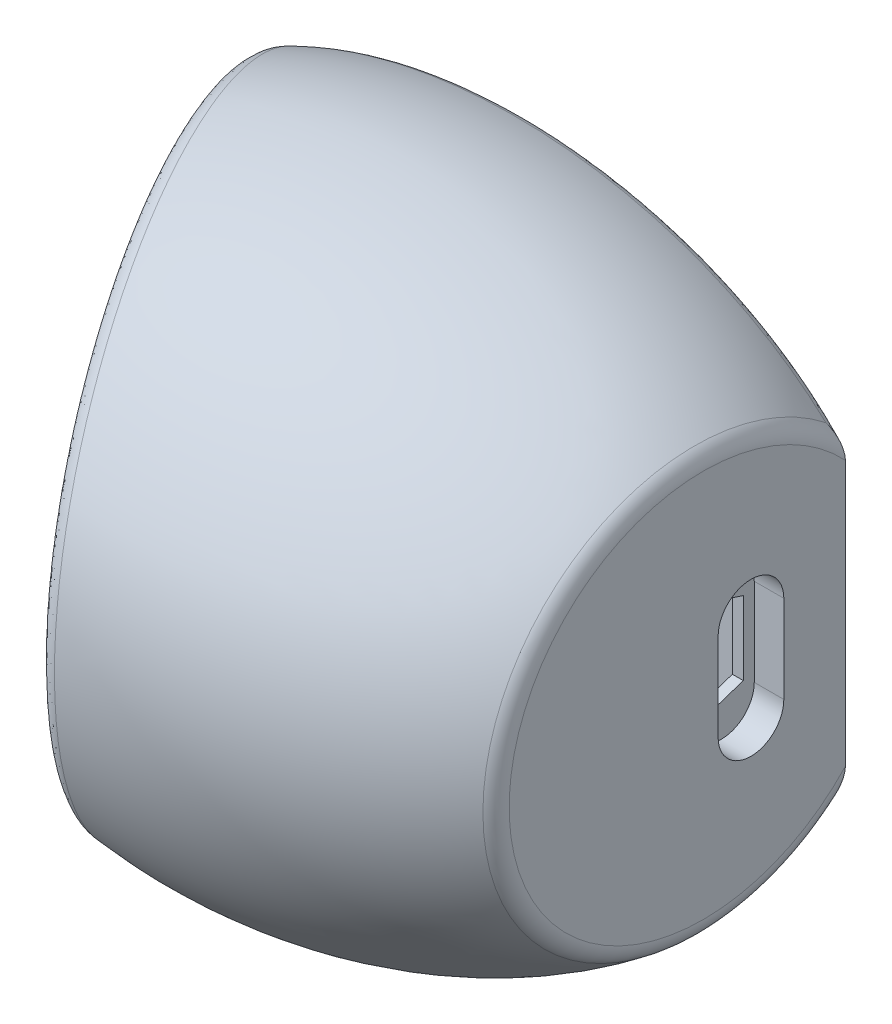
from build123d import *

# Parameters (mm, degrees)
ENL_V_MAT_EXTRU_1_DEPTH      = 56.578773097
ENL_V_MAT_EXTRU_1_DEPTH_BACK = 56.578773097
ENL_V_MAT_EXTRU_2_DEPTH      = 56.578773097
ENL_V_MAT_EXTRU_2_DEPTH_BACK = 56.578773097
ENL_V_MAT_EXTRU_4_DEPTH      = 51.923385764
ENL_V_MAT_EXTRU_4_DEPTH_BACK = 51.923385764
ENL_V_START                  = -3.5
ESQUISSE7_W                  = 14
ESQUISSE7_H                  = 27.96
ENL_V_MAT_EXTRU_6_DEPTH      = 3.5
CONG_2_R                     = 2
CONG_4_R                     = 2
CONG_5_R                     = 2
ESQUISSE9_W                  = 28.42
ESQUISSE9_H                  = 28.16
ENL_V_MAT_EXTRU_7_DEPTH      = 2
ENL_V_MAT_EXTRU_8_DEPTH      = 1.3
ESQUISSE11_W                 = 2.9
ESQUISSE11_H                 = 10.4
ENL_V_MAT_EXTRU_9_DEPTH      = 2
ESQUISSE12_W                 = 31.3
ESQUISSE12_H                 = 32.54
ENL_V_MAT_EXTRU_10_DEPTH     = 17.52
ENL_V_START_2                = -13.78
ENL_V_MAT_EXTRU_11_DEPTH     = 27.56
ENL_V_MAT_EXTRU_5_REACH      = 67.053
ESQUISSE17_W                 = 3
ESQUISSE17_H                 = 32.54
ENL_V_MAT_EXTRU_12_DEPTH     = 6
ESQUISSE18_W                 = 17.52
ESQUISSE18_H                 = 10
ENL_V_MAT_EXTRU_13_DEPTH     = 0.5
ENL_V_MAT_EXTRU_14_DEPTH     = 2.7
ENL_V_MAT_EXTRU_15_DEPTH     = 6.5
ESQUISSE21_W                 = 7.413753449
ESQUISSE21_H                 = 27.56
ENL_V_MAT_EXTRU_16_DEPTH     = 3
ESQUISSE22_W                 = 3.359225522
ESQUISSE22_H                 = 3
ENL_V_MAT_EXTRU_17_DEPTH     = 31.3
CONG_6_R                     = 3


with BuildPart() as part:
    # Esquisse1 → Révolution1 (revolve)
    with BuildSketch(Plane.XY):
        with BuildLine():
            Line((-39, 0), (39, 0))
            add(Edge.make_bspline(
                [(39, 0), (39, 13.18885074), (24.836598095, 21.587983693)],
                knots=[3.141592654, 3.141592654, 3.141592654, 4.022001667, 4.022001667, 4.022001667], degree=2, weights=[1, 0.904664537, 1]))
            add(Edge.make_bspline(
                [(24.836598095, 21.587983693), (0.985525856, 35.732066319), (-23.626759148, 22.276969438)],
                knots=[4.022001667, 4.022001667, 4.022001667, 5.363177993, 5.363177993, 5.363177993], degree=2, weights=[1, 0.783456289, 1]))
            add(Edge.make_bspline(
                [(-23.626759148, 22.276969438), (-39, 13.872693077), (-39, 0)],
                knots=[5.363177993, 5.363177993, 5.363177993, 6.283185307, 6.283185307, 6.283185307], degree=2, weights=[1, 0.896050874, 1]))
        make_face()
    revolve(axis=Axis((-47.667144621, 0, 0), (1, 0, 0)))

    # Esquisse2 → Enlèv. mat.-Extru.1 (cut, two sides: drawn at the far end of the back side and taken through both)
    with BuildSketch(Plane(origin=(0, 0, 0), x_dir=(1, 0, 0), z_dir=(0, 1, 0)).offset(-ENL_V_MAT_EXTRU_1_DEPTH_BACK)):
        Polygon((-315.375795344, 13), (-49.778851167, 13), (82.043171785, 13), (347.640115963, 13), (347.640115963, 544.193888355), (-315.375795344, 544.193888355), align=None)
    extrude(amount=ENL_V_MAT_EXTRU_1_DEPTH + ENL_V_MAT_EXTRU_1_DEPTH_BACK, mode=Mode.SUBTRACT)

    # Esquisse3 → Enlèv. mat.-Extru.2 (cut, two sides: drawn at the far end of the back side and taken through both)
    with BuildSketch(Plane(origin=(0, 0, 0), x_dir=(1, 0, 0), z_dir=(0, 1, 0)).offset(-ENL_V_MAT_EXTRU_2_DEPTH_BACK)):
        Polygon((70.806261288, -187.337541094), (0, -35.493023747), (-24.944206631, 18), (-95.750467919, 169.844517347), (-399.439502613, 28.231994771), (-232.882773406, -328.95006367), align=None)
    extrude(amount=ENL_V_MAT_EXTRU_2_DEPTH + ENL_V_MAT_EXTRU_2_DEPTH_BACK, mode=Mode.SUBTRACT)

    # Esquisse4 → Enlèv. mat.-Extru.4 (cut, two sides: drawn at the far end of the back side and taken through both)
    with BuildSketch(Plane(origin=(9.15, 0, -0.29), x_dir=(0, 0, -1), z_dir=(0, -1, 0)).offset(-ENL_V_MAT_EXTRU_4_DEPTH_BACK)):
        Polygon((-206.938366836, 19.85), (-40.406748296, 19.85), (30.545952829, 19.85), (197.077571368, 19.85), (197.077571368, 352.913237079), (-206.938366836, 352.913237079), align=None)
    extrude(amount=ENL_V_MAT_EXTRU_4_DEPTH + ENL_V_MAT_EXTRU_4_DEPTH_BACK, mode=Mode.SUBTRACT)

    # Esquisse7 → Enlèv. mat.-Extru.6 (cut)
    with BuildSketch(Plane(origin=(-13.594616806, 0, 6.339273926), x_dir=(0.422618261740694, 0, 0.9063077870366525), z_dir=(-0.9063077870366525, 0, 0.422618261740694)).offset(ENL_V_START)):
        with Locations((-1.329929695, 0)):
            Rectangle(ESQUISSE7_W, ESQUISSE7_H)
    extrude(amount=ENL_V_MAT_EXTRU_6_DEPTH, mode=Mode.SUBTRACT)

    # Congé2
    cong_2_edges = [part.edges().sort_by_distance(p)[0] for p in [
        (1.344735833, 24.780393561, -13),
        (-4.095536152, -7.869163051, 26.710118127),
        (1.344735833, -24.780393561, -13),
        (29, -7.009922614, 17.359931767),
    ]]
    fillet(cong_2_edges, radius=CONG_2_R)

    # Congé4
    cong_4_edges = [part.edges().sort_by_distance(p)[0] for p in [
        (-9.612302922, -13.98, 10.738520839),
        (-15.528958586, -13.98, -1.94978818),
        (-15.528958586, 13.98, -1.94978818),
        (-9.612302922, 13.98, 10.738520839),
    ]]
    fillet(cong_4_edges, radius=CONG_4_R)

    # Congé5
    cong_5_edges = [part.edges().sort_by_distance(p)[0] for p in [
        (-14.156669381, -13.98, 5.133948288),
        (-17.114997214, 0, -1.210206222),
        (-14.156669381, 13.98, 5.133948288),
        (-11.198341549, 0, 11.478102797),
        (-16.867433168, -13.394213562, -0.679303412),
        (-16.867433168, 13.394213562, -0.679303412),
        (-11.445905595, 13.394213562, 10.947199987),
        (-11.445905595, -13.394213562, 10.947199987),
    ]]
    fillet(cong_5_edges, radius=CONG_5_R)

    # Esquisse9 → Enlèv. mat.-Extru.7 (cut)
    with BuildSketch(Plane(origin=(-10.422539551, 0, 4.86011001), x_dir=(0.42261826174069395, 0, 0.9063077870366525), z_dir=(-0.9063077870366525, 0, 0.42261826174069395))):
        with Locations((1.360070305, 0)):
            Rectangle(ESQUISSE9_W, ESQUISSE9_H)
    extrude(amount=-ENL_V_MAT_EXTRU_7_DEPTH, mode=Mode.SUBTRACT)

    # Esquisse10 → Enlèv. mat.-Extru.8 (cut)
    with BuildSketch(Plane(origin=(-10.422539551, 0, 4.86011001), x_dir=(-0.4226182617406939, 0, -0.9063077870366525), z_dir=(0.9063077870366525, 0, -0.4226182617406939))):
        Polygon((8.329929695, 13.98), (-11.170070305, 13.98), (-11.170070305, 6), (-11.170070305, -6), (-11.170070305, -13.98), (8.329929695, -13.98), align=None)
    extrude(amount=-ENL_V_MAT_EXTRU_8_DEPTH, mode=Mode.SUBTRACT)

    # Esquisse11 → Enlèv. mat.-Extru.9 (cut)
    with BuildSketch(Plane(origin=(-10.422539551, 0, 4.86011001), x_dir=(-0.4226182617406939, 0, -0.9063077870366525), z_dir=(0.9063077870366525, 0, -0.4226182617406939))):
        with Locations((10.949929695, -0.22)):
            Rectangle(ESQUISSE11_W, ESQUISSE11_H)
    extrude(amount=-ENL_V_MAT_EXTRU_9_DEPTH, mode=Mode.SUBTRACT)

    # Esquisse12 → Enlèv. mat.-Extru.10 (cut)
    with BuildSketch(Plane(origin=(0, 0, -7), x_dir=(-1, 0, 0), z_dir=(0, 0, -1))):
        with Locations((-9.15, 0)):
            Rectangle(ESQUISSE12_W, ESQUISSE12_H)
    extrude(amount=-ENL_V_MAT_EXTRU_10_DEPTH, mode=Mode.SUBTRACT)

    # Enlèv. mat.-Extru.11: read off the stored shape, not the designer's step
    # Enlèv. mat.-Extru.11 outline → Enlèv. mat.-Extru.11 (cut)
    with BuildSketch(Plane(origin=(0, 0, 0), x_dir=(1, 0, 0), z_dir=(0, 1, 0)).offset(ENL_V_START_2)):
        Polygon((-6.5, -8.539620057), (-6.5, 7.359225522), (-13.913753449, 7.359225522), align=None)
    extrude(amount=ENL_V_MAT_EXTRU_11_DEPTH, mode=Mode.SUBTRACT)

    # Esquisse5 → Enlèv. mat.-Extru.5 (cut, up to next)
    with BuildSketch(Plane(origin=(29, 0, 0), x_dir=(0, 0, -1), z_dir=(1, 0, 0)), mode=Mode.PRIVATE) as enl_v_mat_extru_5_sk1:
        Polygon((6.35, 3.36037961), (2.35, 4.693712943), (2.35, -4.693712943), (6.35, -3.36037961), align=None)
    enl_v_mat_extru_5_tool1 = extrude(enl_v_mat_extru_5_sk1.sketch, amount=-ENL_V_MAT_EXTRU_5_REACH, mode=Mode.PRIVATE) & part.part
    add(enl_v_mat_extru_5_tool1.solids().sort_by_distance((29, 0, -4.239635))[0], mode=Mode.SUBTRACT)

    # Esquisse17 → Enlèv. mat.-Extru.12 (cut, along a direction that is not the sketch's normal)
    with BuildSketch(Plane(origin=(0, 0, 10.52), x_dir=(-1, 0, 0), z_dir=(0, 0, -1))):
        with Locations((4.076533666, 0)):
            Rectangle(ESQUISSE17_W, ESQUISSE17_H)
    extrude(amount=-ENL_V_MAT_EXTRU_12_DEPTH, dir=(-0.42261826174069395, 0, -0.9063077870366525), mode=Mode.SUBTRACT)

    # Esquisse18 → Enlèv. mat.-Extru.13 (cut)
    with BuildSketch(Plane.ZY.offset(-24.8)):
        with Locations((1.76, 0)):
            Rectangle(ESQUISSE18_W, ESQUISSE18_H)
    extrude(amount=-ENL_V_MAT_EXTRU_13_DEPTH, mode=Mode.SUBTRACT)

    # Esquisse19 → Enlèv. mat.-Extru.14 (cut)
    with BuildSketch(Plane(origin=(29, 0, 0), x_dir=(0, 0, -1), z_dir=(1, 0, 0))):
        with BuildLine():
            Line((1.35, -4), (1.35, 4))
            ThreePointArc((1.35, 4), (4.35, 7), (7.35, 4))
            Line((7.35, 4), (7.35, -4))
            ThreePointArc((7.35, -4), (4.35, -7), (1.35, -4))
        make_face()
    extrude(amount=-ENL_V_MAT_EXTRU_14_DEPTH, mode=Mode.SUBTRACT)

    # Esquisse20 → Enlèv. mat.-Extru.15 (cut, symmetric)
    with BuildSketch(Plane(origin=(0, 0, 0), x_dir=(1, 0, 0), z_dir=(0, 1, 0))):
        Polygon((-4.138871856, -19.109659414), (-8.063007691, -14.724051547), (-4.410388168, -13.020807091), (-2.029727929, -18.126149449), align=None)
    extrude(amount=ENL_V_MAT_EXTRU_15_DEPTH, both=True, mode=Mode.SUBTRACT)

    # Esquisse21 → Enlèv. mat.-Extru.16 (cut)
    with BuildSketch(Plane.XY.offset(-7.359225522)):
        with Locations((-10.206876725, 0)):
            Rectangle(ESQUISSE21_W, ESQUISSE21_H)
    extrude(amount=-ENL_V_MAT_EXTRU_16_DEPTH, mode=Mode.SUBTRACT)

    # Esquisse22 → Enlèv. mat.-Extru.17 (cut)
    with BuildSketch(Plane.ZY.offset(6.5)):
        with Locations((-8.679612761, 14.77)):
            Rectangle(ESQUISSE22_W, ESQUISSE22_H)
    enl_v_mat_extru_17 = extrude(amount=-ENL_V_MAT_EXTRU_17_DEPTH, mode=Mode.SUBTRACT)

    # Symétrie1: Enlèv. mat.-Extru.17 across plane
    add(enl_v_mat_extru_17.mirror(Plane.ZX), mode=Mode.SUBTRACT)

    # Congé6
    cong_6_edges = [part.edges().sort_by_distance(p)[0] for p in [
        (-6.5, 13.27, -8.679612761),
        (-6.5, -13.27, -8.679612761),
    ]]
    fillet(cong_6_edges, radius=CONG_6_R)


solid = part.part
